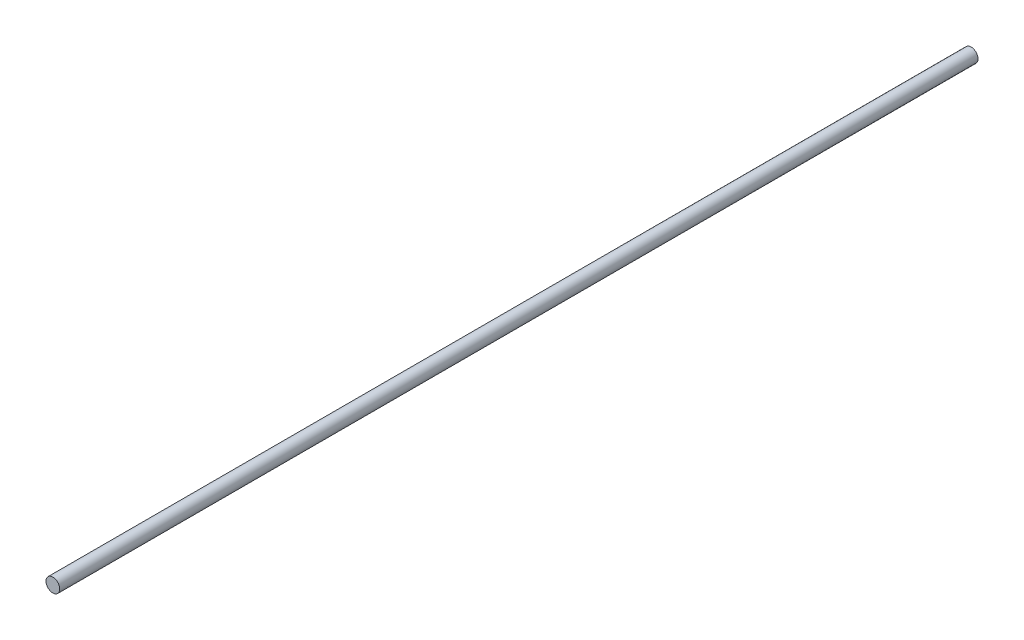
from build123d import *

# Parameters (mm, degrees)
SKETCH2_R           = 1.5
BOSS_EXTRUDE1_DEPTH = 200


with BuildPart() as part:
    # Sketch2 → Boss-Extrude1 (new body)
    with BuildSketch(Plane.XY):
        Circle(SKETCH2_R)
    extrude(amount=BOSS_EXTRUDE1_DEPTH)


solid = part.part
